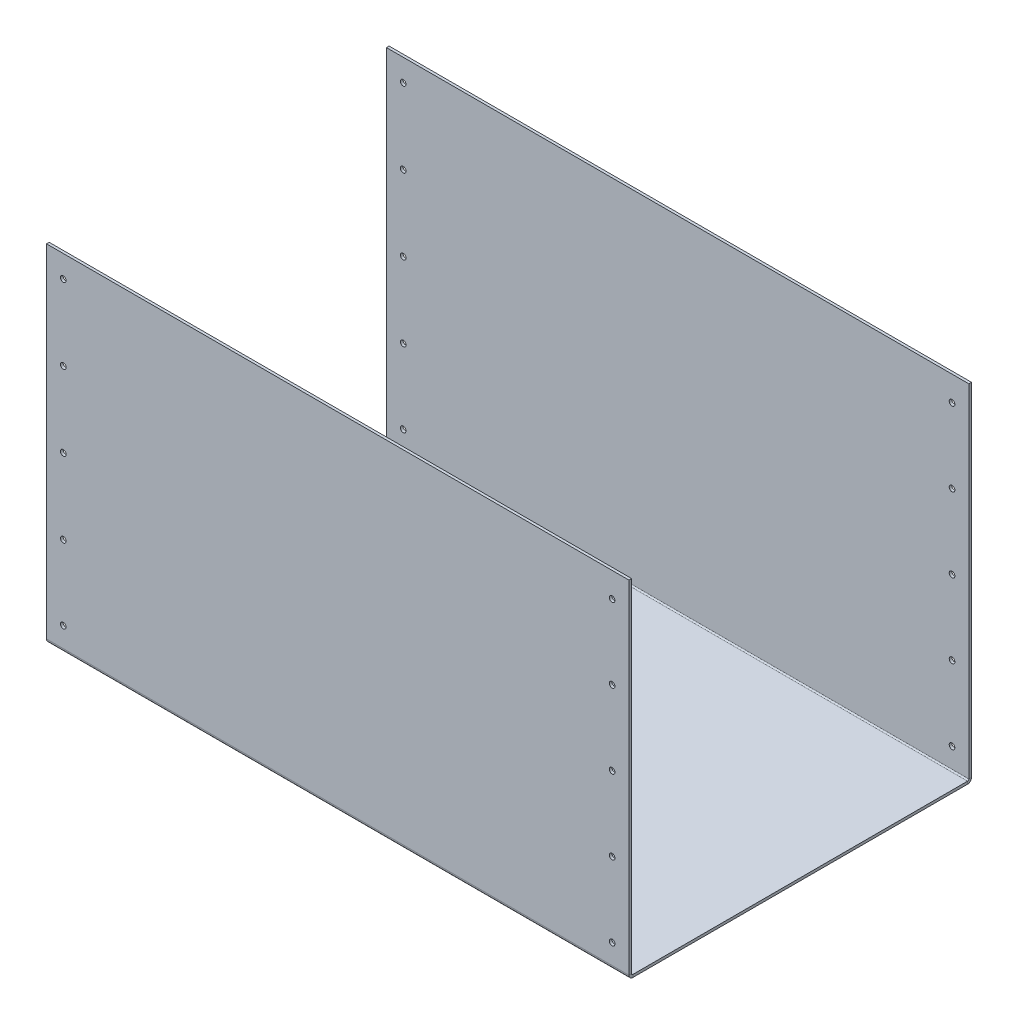
from build123d import *

# Parameters (mm, degrees)
SKETCH_1_W                         = 329
SKETCH_1_H                         = 193.5
SM_BASE_FLANGE_1_DEPTH             = 1.5
SM_EDGE_FLANGE_1_STRIP_W           = 7.4732
SM_EDGE_FLANGE_1_STRIP_H           = 1.5
SM_EDGE_FLANGE_1_STRIP_CUT_DEPTH   = 329
SM_EDGE_FLANGE_1_STRIP_2_W         = 7.4732
SM_EDGE_FLANGE_1_STRIP_2_H         = 1.5
SM_EDGE_FLANGE_1_STRIP_CUT_2_DEPTH = 329
SM_EDGE_FLANGE_1_DEPTH             = 329
SM_EDGE_FLANGE_1_BEND_DEPTH        = 329
SKETCH_21_R                        = 1.6
CUT_EXTRUDE_2_DEPTH                = 217


# Sheet-metal steps are written as plain solids
with BuildPart() as part:
    # Sketch 1 → Базовая кромка1 (new body)
    with BuildSketch(Plane(origin=(0, 0, 0), x_dir=(1, 0, 0), z_dir=(0, 1, 0))):
        with Locations((1.82103321, 33.150369004)):
            Rectangle(SKETCH_1_W, SKETCH_1_H)
    extrude(amount=-SM_BASE_FLANGE_1_DEPTH)

    # Ребро-кромка1 strip (across the edge) → Ребро-кромка1 strip cut (cut)
    with BuildSketch(Plane(origin=(166.32103321, 0, -129.900369004), x_dir=(0, 0, 1), z_dir=(-1, 0, 0))):
        with Locations((-1.5, -0.75)):
            Rectangle(SM_EDGE_FLANGE_1_STRIP_W, SM_EDGE_FLANGE_1_STRIP_H)
    extrude(amount=SM_EDGE_FLANGE_1_STRIP_CUT_DEPTH, mode=Mode.SUBTRACT)

    # Ребро-кромка1 strip 2 (across the edge) → Ребро-кромка1 strip cut 2 (cut)
    with BuildSketch(Plane(origin=(-162.67896679, 0, 63.599630996), x_dir=(0, 0, -1), z_dir=(1, 0, 0))):
        with Locations((-1.5, -0.75)):
            Rectangle(SM_EDGE_FLANGE_1_STRIP_2_W, SM_EDGE_FLANGE_1_STRIP_2_H)
    extrude(amount=SM_EDGE_FLANGE_1_STRIP_CUT_2_DEPTH, mode=Mode.SUBTRACT)

    # Ребро-кромка1 section (across the edge) → Ребро-кромка1 (add)
    with BuildSketch(Plane(origin=(166.32103321, 0, -129.900369004), x_dir=(0, 0, 1), z_dir=(-1, 0, 0))):
        with BuildLine():
            Line((0, 0.7366), (0, 194))
            Line((0, 194), (1.5, 194))
            Line((1.5, 194), (1.5, 0.7366))
            ThreePointArc((1.5, 0.7366), (1.715745145, 0.215745145), (2.2366, 0))
            Line((2.2366, 0), (2.2366, -1.5))
            ThreePointArc((2.2366, -1.5), (0.655084973, -0.844915027), (0, 0.7366))
        make_face()
    extrude(amount=SM_EDGE_FLANGE_1_DEPTH)

    # Ребро-кромка1 section 2 (across the edge) → Ребро-кромка1 bend (add)
    with BuildSketch(Plane(origin=(-162.67896679, 0, 63.599630996), x_dir=(0, 0, -1), z_dir=(1, 0, 0))):
        with BuildLine():
            Line((0, 0.7366), (0, 194))
            Line((0, 194), (1.5, 194))
            Line((1.5, 194), (1.5, 0.7366))
            ThreePointArc((1.5, 0.7366), (1.715745145, 0.215745145), (2.2366, 0))
            Line((2.2366, 0), (2.2366, -1.5))
            ThreePointArc((2.2366, -1.5), (0.655084973, -0.844915027), (0, 0.7366))
        make_face()
    extrude(amount=SM_EDGE_FLANGE_1_BEND_DEPTH)

    # Эскиз21 → Вырез-Вытянуть2 (cut)
    with BuildSketch(Plane(origin=(0, 0, -129.900369004), x_dir=(-1, 0, 0), z_dir=(0, 0, -1))):
        with Locations((-156.82103321, 12)):
            Circle(SKETCH_21_R)
        with Locations((-156.82103321, 54)):
            Circle(SKETCH_21_R)
        with Locations((-156.82103321, 96)):
            Circle(SKETCH_21_R)
        with Locations((-156.82103321, 138)):
            Circle(SKETCH_21_R)
        with Locations((-156.82103321, 180)):
            Circle(SKETCH_21_R)
        with Locations((153.17896679, 181.5)):
            Circle(SKETCH_21_R)
        with Locations((153.17896679, 139)):
            Circle(SKETCH_21_R)
        with Locations((153.17896679, 96.5)):
            Circle(SKETCH_21_R)
        with Locations((153.17896679, 54)):
            Circle(SKETCH_21_R)
        with Locations((153.17896679, 12)):
            Circle(SKETCH_21_R)
    extrude(amount=-CUT_EXTRUDE_2_DEPTH, mode=Mode.SUBTRACT)


solid = part.part
